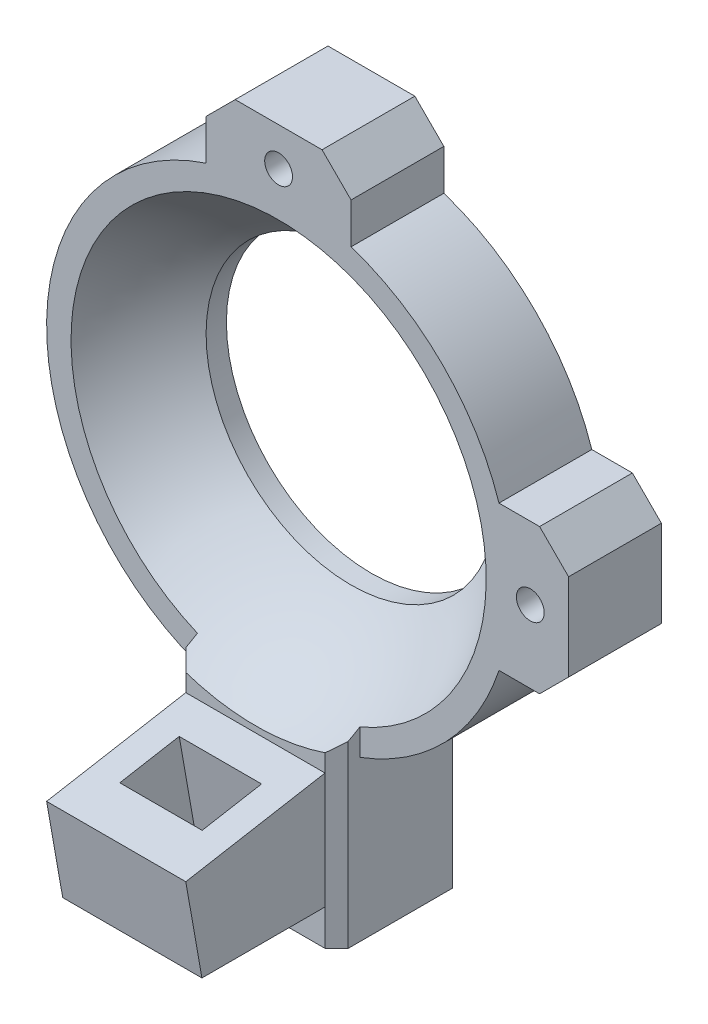
from build123d import *

# Parameters (mm, degrees)
SKETCH1_R            = 12.5
BOSS_EXTRUDE1_DEPTH  = 8
BOSS_EXTRUDE2_DEPTH  = 10
SKETCH4_W            = 6.3
SKETCH4_H            = 6.3
CUT_EXTRUDE1_DEPTH   = 12
BOSS_EXTRUDE4_DEPTH  = 6
SKETCH13_W           = 7.1
SKETCH13_H           = 5.2
CUT_EXTRUDE5_DEPTH   = 51.192153127
SKETCH22_W           = 12.489995996
SKETCH22_H           = 4
BOSS_EXTRUDE10_DEPTH = 8
SKETCH24_R           = 1.2
CUT_EXTRUDE8_DEPTH   = 6.5
CIRPATTERN1_COUNT    = 2
CIRPATTERN1_ANGLE    = 90
CHAMFER1_SIZE        = 2.5
CHAMFER2_SIZE        = 1


with BuildPart() as part:
    # Sketch1 → Boss-Extrude1 (new body)
    with BuildSketch(Plane.XY):
        with BuildLine():
            Line((-6.244997998, 21), (6.244997998, 21))
            Line((6.244997998, 21), (6.244997998, 19))
            ThreePointArc((6.244997998, 19), (14.142135624, 14.142135624), (19, 6.244997998))
            Line((19, 6.244997998), (21, 6.244997998))
            Line((21, 6.244997998), (21, -6.244997998))
            Line((21, -6.244997998), (19, -6.244997998))
            ThreePointArc((19, -6.244997998), (11.728172066, -16.200308021), (0, -20))
            ThreePointArc((0, -20), (-19.748417658, -3.16227766), (-6.244997998, 19))
            Line((-6.244997998, 19), (-6.244997998, 21))
        make_face()
        Circle(SKETCH1_R, mode=Mode.SUBTRACT)
    extrude(amount=BOSS_EXTRUDE1_DEPTH)

    # Sketch3 → Boss-Extrude2 (add)
    with BuildSketch(Plane.XY):
        Polygon((-7, -18.734993995), (-7, -32.5), (7, -32.5), (7, -18.734993995), (7, -15.234993995), (-7, -15.234993995), align=None)
    extrude(amount=BOSS_EXTRUDE2_DEPTH)

    # Sketch2 → Cut-Revolve2 (revolve, cut)
    with BuildSketch(Plane(origin=(0, 0, 0), x_dir=(1, 0, 0), z_dir=(0, 1, 0))):
        with BuildLine():
            Line((0, -38.5), (0, 2.5))
            ThreePointArc((0, 2.5), (-20.5, -18), (0, -38.5))
        make_face()
    revolve(axis=Axis((0, 0, 8), (0, 0, -1)), mode=Mode.SUBTRACT)

    # Sketch4 → Cut-Extrude1 (cut)
    with BuildSketch(Plane.XZ.offset(32.5)):
        with Locations((0, 5)):
            Rectangle(SKETCH4_W, SKETCH4_H)
    extrude(amount=-CUT_EXTRUDE1_DEPTH, mode=Mode.SUBTRACT)

    # Sketch11 → Boss-Extrude4 (add, symmetric)
    with BuildSketch(Plane(origin=(0, 0, 0), x_dir=(0, 0, -1), z_dir=(1, 0, 0))):
        Polygon((-10, -19.405629698), (-22, -21.521553466), (-20.609824642, -29.405629698), (-10, -29.405629698), align=None)
    extrude(amount=BOSS_EXTRUDE4_DEPTH, both=True)

    # Sketch13 → Cut-Extrude5 (cut, through all)
    with BuildSketch(Plane(origin=(0, -17.110377647, -3.017021229), x_dir=(1, 0, 0), z_dir=(0, 0.9848077530122074, 0.17364817766693455))):
        with Locations((0, -18.884652651)):
            Rectangle(SKETCH13_W, SKETCH13_H)
    extrude(amount=-CUT_EXTRUDE5_DEPTH, mode=Mode.SUBTRACT)

    # Sketch22 → Boss-Extrude10 (add)
    with BuildSketch(Plane.XY):
        with Locations((0, 23)):
            Rectangle(SKETCH22_W, SKETCH22_H)
    boss_extrude10 = extrude(amount=BOSS_EXTRUDE10_DEPTH)

    # Sketch24 → Cut-Extrude8 (cut)
    with BuildSketch(Plane.XY.offset(8)):
        with Locations((0, 21.7)):
            Circle(SKETCH24_R)
    cut_extrude8 = extrude(amount=-CUT_EXTRUDE8_DEPTH, mode=Mode.SUBTRACT)

    # CirPattern1: Boss-Extrude10, Cut-Extrude8 ×2 about axis
    cirpattern1_axis = Axis((0, 0, 0), (0, 0, -1))
    add([boss_extrude10.rotate(cirpattern1_axis, i * CIRPATTERN1_ANGLE / (CIRPATTERN1_COUNT - 1)) for i in range(1, CIRPATTERN1_COUNT)])
    add([cut_extrude8.rotate(cirpattern1_axis, i * CIRPATTERN1_ANGLE / (CIRPATTERN1_COUNT - 1)) for i in range(1, CIRPATTERN1_COUNT)], mode=Mode.SUBTRACT)

    # Chamfer1
    chamfer1_edges = [part.edges().sort_by_distance(p)[0] for p in [
        (-6.244997998, 25, 4),
        (6.244997998, 25, 4),
        (25, 6.244997998, 4),
        (25, -6.244997998, 4),
    ]]
    chamfer(chamfer1_edges, length=CHAMFER1_SIZE)

    # Chamfer2
    chamfer2_edges = [part.edges().sort_by_distance(p)[0] for p in [
        (7, -25.014274071, 10),
        (-7, -25.014274071, 10),
    ]]
    chamfer(chamfer2_edges, length=CHAMFER2_SIZE - 0.0001)  # a hair under: the kernel refuses the full size


solid = part.part
